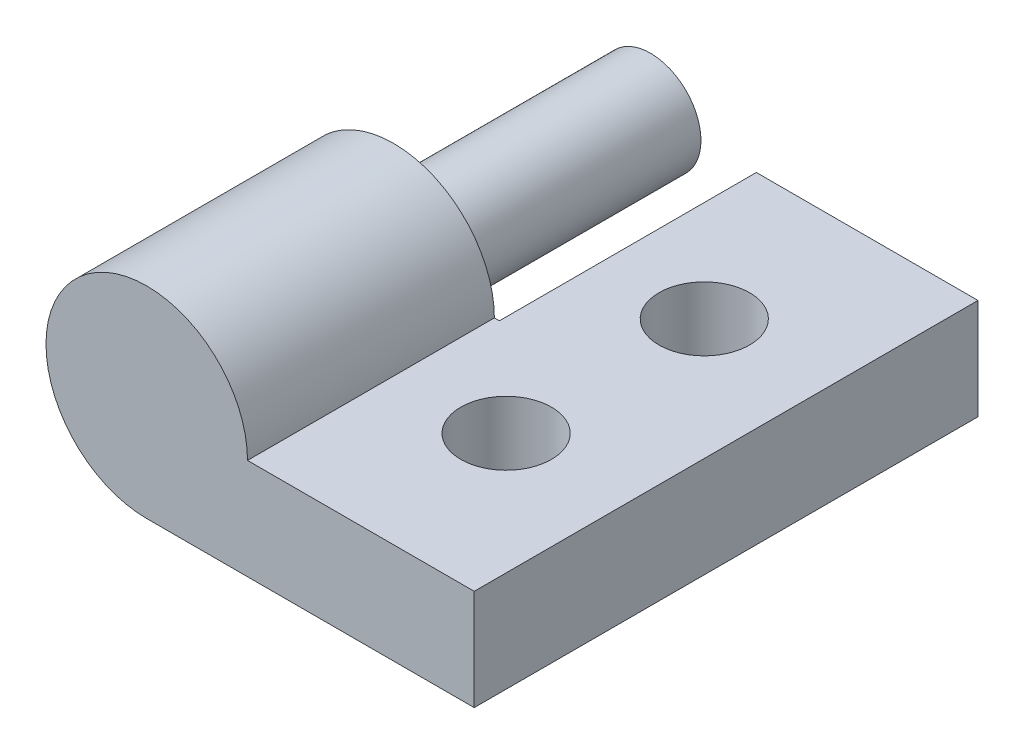
from build123d import *

# Parameters (mm, degrees)
BOSS_EXTRUDE1_DEPTH = 25.4
SKETCH5_R           = 2.286
CUT_EXTRUDE3_DEPTH  = 12.954
SKETCH8_R           = 5.334
CUT_EXTRUDE5_DEPTH  = 12.954
SKETCH9_R           = 2.54
BOSS_EXTRUDE2_DEPTH = 12.954


with BuildPart() as part:
    # Sketch2 → Boss-Extrude1 (new body)
    with BuildSketch(Plane.XY):
        with BuildLine():
            Line((0, 0), (-16.51, 0))
            ThreePointArc((-16.51, 0), (-20.102102448, 8.672102448), (-11.43, 5.08))
            Line((-11.43, 5.08), (0, 5.08))
            Line((0, 5.08), (0, 0))
        make_face()
    extrude(amount=BOSS_EXTRUDE1_DEPTH)

    # Sketch5 → Cut-Extrude3 (cut)
    with BuildSketch(Plane(origin=(0, 5.08, 0), x_dir=(1, 0, 0), z_dir=(0, 1, 0))):
        with Locations((-6.096, -17.695333333)):
            Circle(SKETCH5_R)
        with Locations((-6.096, -7.704666667)):
            Circle(SKETCH5_R)
    extrude(amount=-CUT_EXTRUDE3_DEPTH, mode=Mode.SUBTRACT)

    # Sketch8 → Cut-Extrude5 (cut)
    with BuildSketch(Plane(origin=(0, 0, 0), x_dir=(-1, 0, 0), z_dir=(0, 0, -1))):
        with Locations((16.51, 5.08)):
            Circle(SKETCH8_R)
    extrude(amount=-CUT_EXTRUDE5_DEPTH, mode=Mode.SUBTRACT)

    # Sketch9 → Boss-Extrude2 (add)
    with BuildSketch(Plane(origin=(0, 0, 12.954), x_dir=(-1, 0, 0), z_dir=(0, 0, -1))):
        with Locations((16.51, 5.08)):
            Circle(SKETCH9_R)
    extrude(amount=BOSS_EXTRUDE2_DEPTH)


solid = part.part
